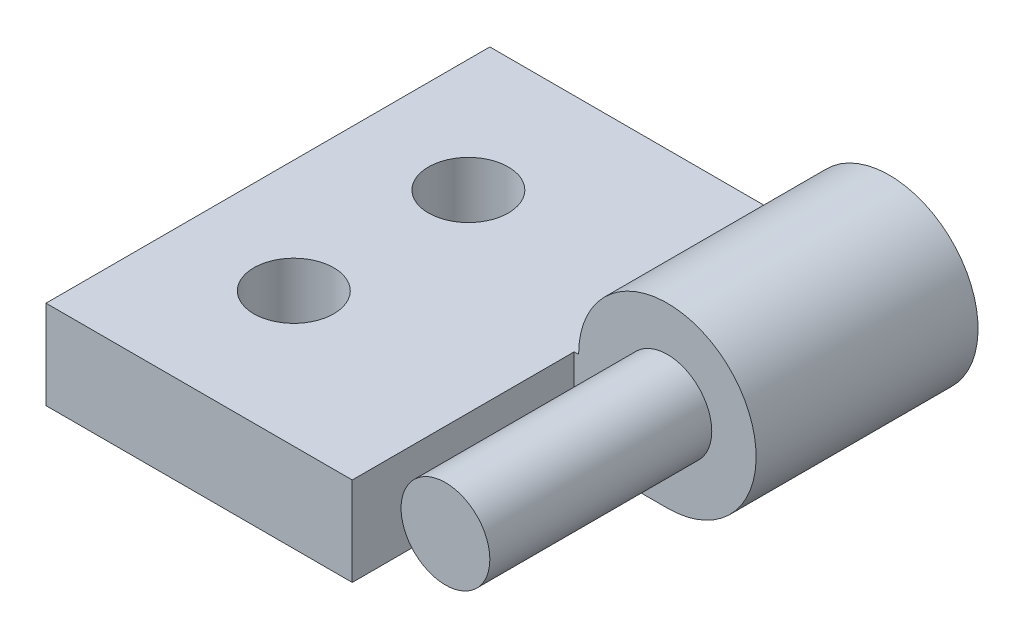
from build123d import *

# Parameters (mm, degrees)
BOSS_EXTRUDE1_DEPTH = 25.4
SKETCH2_R           = 2.54
CUT_EXTRUDE1_DEPTH  = 12.7
SKETCH3_R           = 2.286
CUT_EXTRUDE2_DEPTH  = 39.1


with BuildPart() as part:
    # Sketch1 → Boss-Extrude1 (new body)
    with BuildSketch(Plane.XY):
        with BuildLine():
            Line((0, 0), (0, 5.08))
            Line((0, 5.08), (17.78, 5.08))
            ThreePointArc((17.78, 5.08), (26.452102448, 8.672102448), (22.86, 0))
            Line((22.86, 0), (0, 0))
        make_face()
    extrude(amount=BOSS_EXTRUDE1_DEPTH)

    # Sketch2 → Cut-Extrude1 (cut)
    with BuildSketch(Plane.XY.offset(25.4)):
        with BuildLine():
            Line((17.526, 5.08), (17.526, 0))
            Line((17.526, 0), (21.233606444, 0))
            ThreePointArc((21.233606444, 0), (27.168522904, 8.224548678), (17.526, 5.08))
        make_face()
        with Locations((22.86, 5.08)):
            Circle(SKETCH2_R, mode=Mode.SUBTRACT)
    extrude(amount=-CUT_EXTRUDE1_DEPTH, mode=Mode.SUBTRACT)

    # Sketch3 → Cut-Extrude2 (cut, through all)
    with BuildSketch(Plane(origin=(0, 5.08, 0), x_dir=(1, 0, 0), z_dir=(0, 1, 0))):
        with Locations((6.477, -7.704666667)):
            Circle(SKETCH3_R)
        with Locations((6.477, -17.695333333)):
            Circle(SKETCH3_R)
    extrude(amount=-CUT_EXTRUDE2_DEPTH, mode=Mode.SUBTRACT)


solid = part.part
